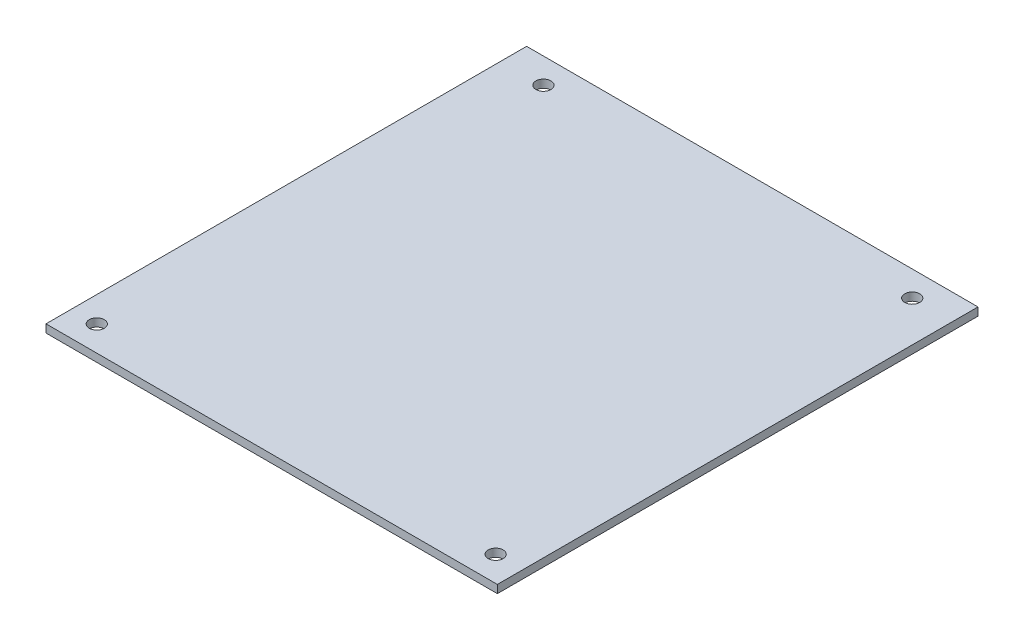
from build123d import *

# Parameters (mm, degrees)
SKETCH2_W           = 84.57
SKETCH2_H           = 90.8
BOSS_EXTRUDE1_DEPTH = 1.6
SKETCH3_R           = 1.5
CUT_EXTRUDE1_DEPTH  = 125.093855206
SKETCH4_W           = 90.8
SKETCH4_H           = 1.6
BOSS_EXTRUDE2_DEPTH = 2.88
SKETCH5_W           = 90.8
SKETCH5_H           = 1.6
BOSS_EXTRUDE3_DEPTH = 2.59
SKETCH6_W           = 90.04
SKETCH6_H           = 1.6
BOSS_EXTRUDE4_DEPTH = 2.54
SKETCH7_W           = 90.04
SKETCH7_H           = 1.6
BOSS_EXTRUDE5_DEPTH = 2.54


with BuildPart() as part:
    # Sketch2 → Boss-Extrude1 (new body)
    with BuildSketch(Plane(origin=(0, 0, 0), x_dir=(1, 0, 0), z_dir=(0, 1, 0))):
        with Locations((42.285, 45.4)):
            Rectangle(SKETCH2_W, SKETCH2_H)
    extrude(amount=BOSS_EXTRUDE1_DEPTH)

    # Sketch3 → Cut-Extrude1 (cut, through all)
    with BuildSketch(Plane(origin=(0, 1.6, 0), x_dir=(1, 0, 0), z_dir=(0, 1, 0))):
        with Locations((2.5, 2.5)):
            Circle(SKETCH3_R)
        with Locations((82.07, 2.5)):
            Circle(SKETCH3_R)
        with Locations((5.8, 88.3)):
            Circle(SKETCH3_R)
        with Locations((79.37, 88.3)):
            Circle(SKETCH3_R)
    extrude(amount=-CUT_EXTRUDE1_DEPTH, mode=Mode.SUBTRACT)

    # Sketch4 → Boss-Extrude2 (add)
    with BuildSketch(Plane(origin=(84.57, 0, 0), x_dir=(0, 0, -1), z_dir=(1, 0, 0))):
        with Locations((45.4, 0.8)):
            Rectangle(SKETCH4_W, SKETCH4_H)
    extrude(amount=BOSS_EXTRUDE2_DEPTH)

    # Sketch5 → Boss-Extrude3 (add)
    with BuildSketch(Plane.ZY):
        with Locations((-45.4, 0.8)):
            Rectangle(SKETCH5_W, SKETCH5_H)
    extrude(amount=BOSS_EXTRUDE3_DEPTH)

    # Sketch6 → Boss-Extrude4 (add)
    with BuildSketch(Plane(origin=(0, 0, -90.8), x_dir=(-1, 0, 0), z_dir=(0, 0, -1))):
        with Locations((-42.43, 0.8)):
            Rectangle(SKETCH6_W, SKETCH6_H)
    extrude(amount=BOSS_EXTRUDE4_DEPTH)

    # Sketch7 → Boss-Extrude5 (add)
    with BuildSketch(Plane.XY):
        with Locations((42.43, 0.8)):
            Rectangle(SKETCH7_W, SKETCH7_H)
    extrude(amount=BOSS_EXTRUDE5_DEPTH)


solid = part.part
